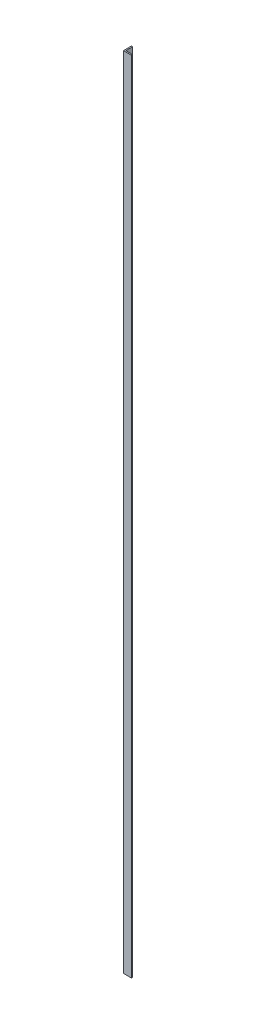
from build123d import *

# Parameters (mm, degrees)
BOSS_EXTRUDE1_DEPTH = 5080


with BuildPart() as part:
    # Sketch1 → Boss-Extrude1 (new body)
    with BuildSketch(Plane(origin=(0, 0, 0), x_dir=(1, 0, 0), z_dir=(0, 1, 0))):
        Polygon((0, 0), (0, 50.8), (7.62, 50.8), (7.62, 7.62), (50.8, 7.62), (50.8, 0), align=None)
    extrude(amount=BOSS_EXTRUDE1_DEPTH)


solid = part.part
